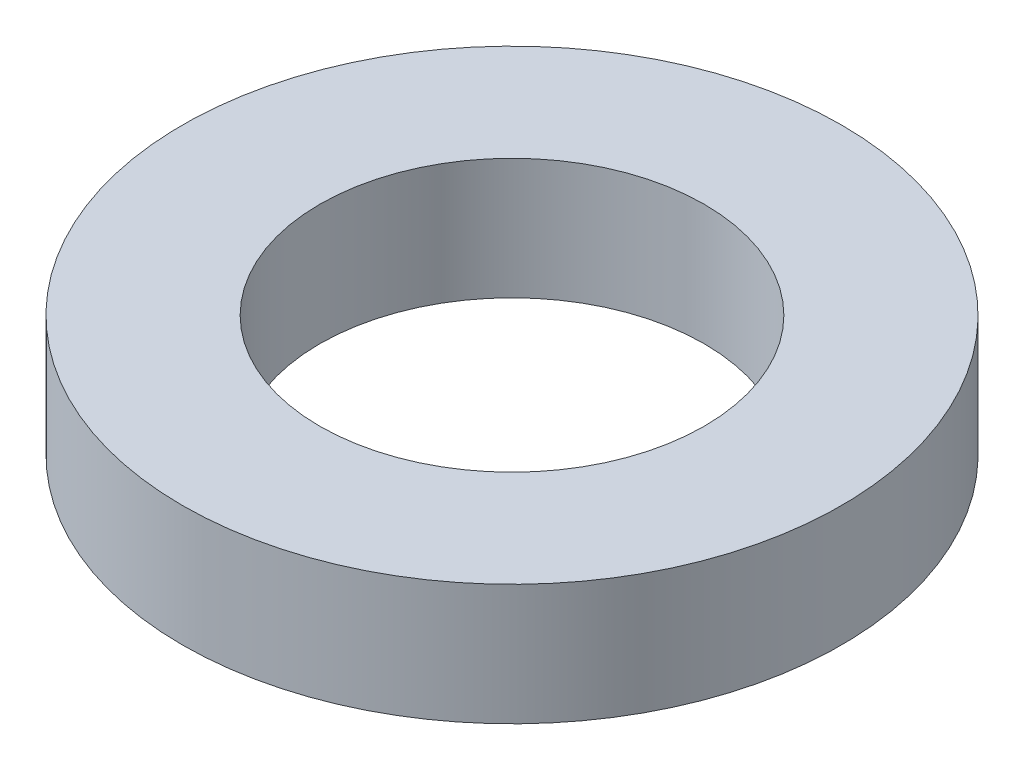
from build123d import *

# Parameters (mm, degrees)
SKETCH1_R           = 60
BOSS_EXTRUDE1_DEPTH = 22
SKETCH2_R           = 35
CUT_EXTRUDE1_DEPTH  = 88.658428003


with BuildPart() as part:
    # Sketch1 → Boss-Extrude1 (new body)
    with BuildSketch(Plane(origin=(0, 0, 0), x_dir=(1, 0, 0), z_dir=(0, 1, 0))):
        Circle(SKETCH1_R)
    extrude(amount=BOSS_EXTRUDE1_DEPTH)

    # Sketch2 → Cut-Extrude1 (cut, through all)
    with BuildSketch(Plane(origin=(0, 0, 0), x_dir=(1, 0, 0), z_dir=(0, 1, 0))):
        Circle(SKETCH2_R)
    extrude(amount=CUT_EXTRUDE1_DEPTH, mode=Mode.SUBTRACT)


solid = part.part
